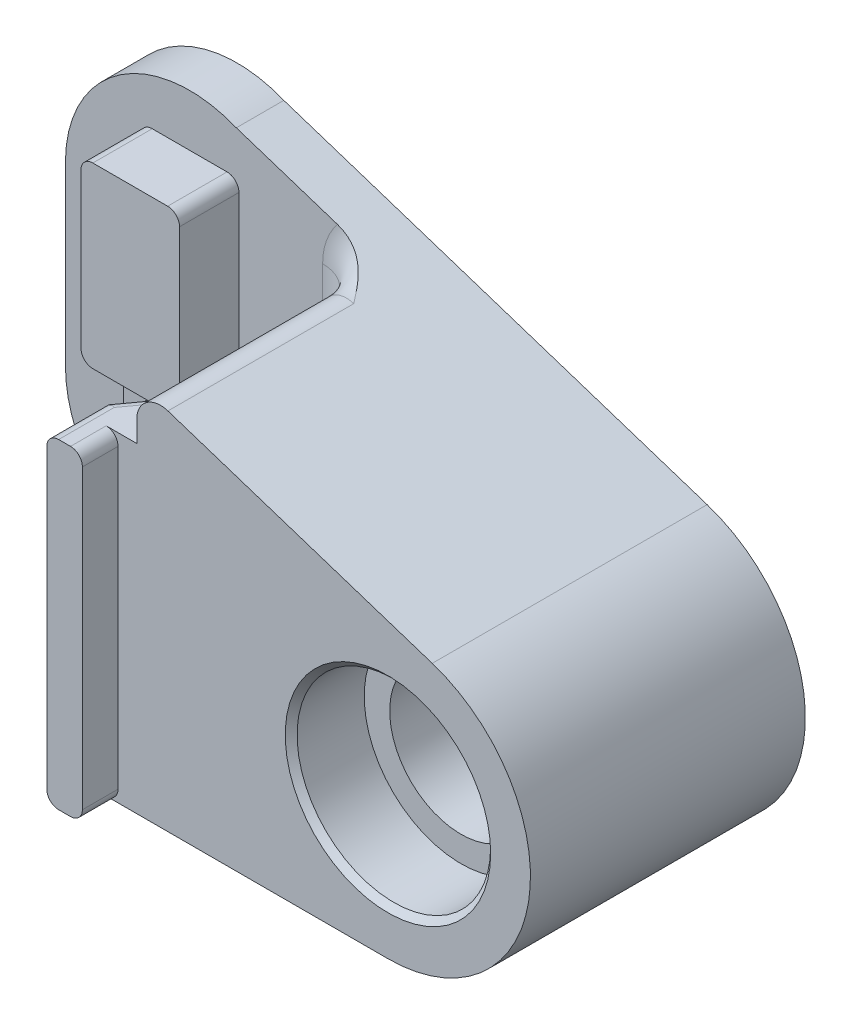
from build123d import *

# Parameters (mm, degrees)
SKETCH_1_R          = 3.2500000000000004
SKETCH_1_R_2        = 8.149999999999999
EXTRUDE_1_DEPTH     = 4
SKETCH_1_3_R        = 11.999999999999993
SKETCH_1_3_R_2      = 8.149999999999999
SKETCH_1_3_R_3      = 9.500000000000002
EXTRUDE_2_DEPTH     = 23.15
EXTRUDE_START       = 9
SKETCH_1_4_R        = 8.149999999999999
SKETCH_1_4_R_2      = 5.999999999999998
EXTRUDE_3_DEPTH     = 8
EXTRUDE_4_DEPTH     = 9.000000000000002
FILLET_1_R          = 2
EXTRUDE_5_DEPTH     = 27
FILLET_2_R          = 1
SKETCH_1_6_R        = 9.500000000000002
SKETCH_1_6_R_2      = 8.149999999999999
CUT_EXTRUDE_1_DEPTH = 2
CHAMFER_1_SIZE      = 2.3
CHAMFER_2_SIZE      = 1.3
FILLET_4_R          = 3.5
SKETCH_1_7_R        = 3.2500000000000004
EXTRUDE_6_DEPTH     = 5.4
FILLET_3_R          = 1
CHAMFER_3_SIZE      = 0.5


with BuildPart() as part:
    # Эскиз1 → Бобышка-Вытянуть1 (new body)
    with BuildSketch(Plane.XY):
        with BuildLine():
            Line((-14.999999999999972, -8.963730931198981), (20.850000000000577, -8.96373093119897))
            ThreePointArc((20.85000000000058, -8.963730931198967), (32.70050757538239, 1.1480237971749345), (24.57944414926456, 14.44202403449797))
            Line((24.57944414926456, 14.44202403449797), (-11.068586896529624, 26.098187192163547))
            ThreePointArc((-11.068586896529625, 26.098187192163547), (-20.788047002520305, 25.117990405859814), (-25.455246310980815, 16.536269068801015))
            Line((-25.455246310980815, 16.536269068801015), (-25.45524631098081, 1.4915153797818874))
            ThreePointArc((-25.45524631098081, 1.4915153797818874), (-22.392975565470174, -5.9014601856883235), (-14.999999999999972, -8.96373093119898))
        make_face()
        Polygon((-10.849999999999971, 7.491515379781886), (-19.149999999999974, 7.491515379781886), (-19.149999999999974, 22.491515379781884), (-10.849999999999973, 22.491515379781884), align=None, mode=Mode.SUBTRACT)
        with Locations((-14.999999999999972, 1.4915153797818852)):
            Circle(SKETCH_1_R, mode=Mode.SUBTRACT)
        with Locations((20.85000000000058, 3.036269068801026)):
            Circle(SKETCH_1_R_2, mode=Mode.SUBTRACT)
    extrude(amount=EXTRUDE_1_DEPTH)

    # Эскиз1<3> → Бобышка-Вытянуть2 (add)
    # profile 1 of 3: a face of its own
    with BuildSketch(Plane.XY):
        with BuildLine():
            Line((-0.29999999999996874, -8.96373093119897), (20.85000000000058, -8.96373093119897))
            ThreePointArc((20.850000000000577, -8.963730931198967), (8.999492424618776, 4.924514340427118), (24.57944414926456, 14.44202403449797))
            Line((24.57944414926456, 14.442024034497972), (-0.2999999999999723, 22.57708372133782))
            Line((-0.2999999999999722, 22.57708372133782), (-0.2999999999999704, -8.96373093119897))
        make_face()
    # profile 2 of 3: a face of its own
    with BuildSketch(Plane.XY):
        with Locations((20.85000000000058, 3.036269068801026)):
            Circle(SKETCH_1_3_R)
        with Locations((20.85000000000058, 3.036269068801026)):
            Circle(SKETCH_1_3_R_2, mode=Mode.SUBTRACT)
    # profile 3 of 3: a face of its own
    with BuildSketch(Plane.XY):
        with Locations((20.85000000000058, 3.036269068801026)):
            Circle(SKETCH_1_3_R_3)
        with Locations((20.85000000000058, 3.036269068801026)):
            Circle(SKETCH_1_3_R_2, mode=Mode.SUBTRACT)
    extrude(amount=EXTRUDE_2_DEPTH)

    # Эскиз1<4> → Бобышка-Вытянуть3 (add)
    with BuildSketch(Plane.XY.offset(EXTRUDE_START)):
        with Locations((20.85000000000058, 3.036269068801026)):
            Circle(SKETCH_1_4_R)
        with Locations((20.85000000000058, 3.036269068801026)):
            Circle(SKETCH_1_4_R_2, mode=Mode.SUBTRACT)
    extrude(amount=EXTRUDE_3_DEPTH)

    # Эскиз1<5> → Бобышка-Вытянуть4 (add)
    with BuildSketch(Plane.XY):
        Polygon((-10.849999999999971, 7.491515379781886), (-10.849999999999973, 22.491515379781884), (-19.149999999999974, 22.491515379781884), (-19.149999999999974, 7.491515379781886), align=None)
    extrude(amount=EXTRUDE_4_DEPTH)

    # Скругление1
    fillet_1_edges = [part.edges().sort_by_distance(p)[0] for p in [
        (-0.29999999999997223, 22.57708372133782, 13.575),
    ]]
    fillet(fillet_1_edges, radius=FILLET_1_R)

    # Эскиз4 → Бобышка-Вытянуть5 (add)
    with BuildSketch(Plane.XZ.offset(8.96373093119897)):
        Polygon((-4.879999999999971, 26.15), (-4.87999999999997, 21.15), (-0.2999999999999704, 14.85), (-0.2999999999999704, 23.150000000000002), (-1.8799999999999704, 23.150000000000002), (-1.8799999999999704, 26.15), align=None)
    extrude(amount=-EXTRUDE_5_DEPTH)

    # Скругление2
    fillet_2_edges = [part.edges().sort_by_distance(p)[0] for p in [
        (-0.29999999999996957, -8.96373093119897, 9.425),
        (-2.589999999999968, 18.03626906880103, 18),
        (-4.879999999999969, 18.03626906880103, 23.65),
        (-1.8799999999999681, 18.03626906880103, 24.65),
        (-2.58999999999997, -8.96373093119897, 18),
        (-1.8799999999999704, -8.96373093119897, 24.65),
        (-4.879999999999971, -8.96373093119897, 23.65),
    ]]
    fillet(fillet_2_edges, radius=FILLET_2_R)

    # Эскиз1<6> → Вырез-Вытянуть1 (cut)
    with BuildSketch(Plane.XY):
        with Locations((20.85000000000058, 3.036269068801026)):
            Circle(SKETCH_1_6_R)
        with Locations((20.85000000000058, 3.036269068801026)):
            Circle(SKETCH_1_6_R_2, mode=Mode.SUBTRACT)
    extrude(amount=CUT_EXTRUDE_1_DEPTH, mode=Mode.SUBTRACT)

    # Фаска1
    # the kernel refuses this chamfer: 2.3 mm, written as the material it takes off along each edge
    with BuildSketch(Plane(origin=(20.85000000000058, 3.036269068801026, 9), x_dir=(1, 0, 0), z_dir=(0, -1, 0))) as chamfer_1_piece_1_section:
        Polygon((5.9999999999999964, CHAMFER_1_SIZE), (5.9999999999999964 + CHAMFER_1_SIZE, 0), (5.9999999999999964, 0), align=None)
    chamfer_1_piece_1 = revolve(axis=Axis((20.85000000000058, 3.036269068801026, 9), (0, 0, 1)), mode=Mode.PRIVATE)
    chamfer_1_piece_1 = chamfer_1_piece_1 & Plane(origin=(20.85000000000058, 3.036269068801026, 10.222457747954977), x_dir=(1, 0, 0), z_dir=(0, 0, -1)) * Cylinder(8.149999999999999, 34, mode=Mode.PRIVATE)
    add(chamfer_1_piece_1, mode=Mode.SUBTRACT)

    # Фаска2
    chamfer_2_edges = [part.edges().sort_by_distance(p)[0] for p in [
        (12.700000000000582, 3.036269068801027, 2),
    ]]
    chamfer(chamfer_2_edges, length=CHAMFER_2_SIZE)

    # Скругление4
    # the kernel refuses this fillet: 3.5 mm, written as the material it adds along each edge
    with BuildSketch(Plane(origin=(0.7000000000000293, -7.963730931198976, 4), x_dir=(-0.9999802608561372, 0.006283143965558403, 0), z_dir=(-0.006283143965558403, -0.9999802608561372, 0))) as fillet_4_piece_1_section:
        with BuildLine():
            CenterArc((-0.9999999999999992 - FILLET_4_R, -FILLET_4_R), FILLET_4_R, 0, 90)
            Line((-0.9999999999999979, -FILLET_4_R), (-0.9999999999999992, 0))
            Line((-0.9999999999999992, 0), (-0.9999999999999992 - FILLET_4_R, 0))
        make_face()
    fillet_4_piece_1 = revolve(axis=Axis((0.7000000000000293, -7.963730931198976, 4), (0, 0, -1)), revolution_arc=359.64000000000004, mode=Mode.PRIVATE)
    fillet_4_piece_1 = split(fillet_4_piece_1, bisect_by=Plane(origin=(-0.06522476751896455, -8.963730931198977, 5.353005928395178), z_dir=(-3e-16, 1, 0)), keep=Keep.TOP, mode=Mode.PRIVATE)
    add(fillet_4_piece_1)
    with BuildSketch(Plane(origin=(-0.2999999999999705, -7.963730931198976, 4), x_dir=(-1, -6e-17, 0), z_dir=(-6e-17, 1, 0))) as fillet_4_piece_2:
        with BuildLine():
            CenterArc((FILLET_4_R, FILLET_4_R), FILLET_4_R, 180, 90)
            Line((-4.4e-16, FILLET_4_R), (0, 0))
            Line((0, 0), (FILLET_4_R, 0))
        make_face()
    extrude(amount=27.782655425625357)
    with BuildSketch(Plane(origin=(1.7000000000000277, 19.818924494426383, 4), x_dir=(-0.9998226837850567, -0.018830852047809543, 0), z_dir=(-0.018830852047809543, 0.9998226837850567, 0))) as fillet_4_piece_3_section:
        with BuildLine():
            CenterArc((-2.000000000000004 - FILLET_4_R, FILLET_4_R), FILLET_4_R, 270, 90)
            Line((-2.000000000000004, FILLET_4_R), (-2.000000000000004, 0))
            Line((-2.000000000000004, 0), (-2.000000000000004 - FILLET_4_R, 0))
        make_face()
    fillet_4_piece_3 = revolve(axis=Axis((1.7000000000000277, 19.818924494426383, 4), (0, 0, 1)), revolution_arc=358.921007878005, mode=Mode.PRIVATE)
    fillet_4_piece_3 = split(fillet_4_piece_3, bisect_by=Plane(origin=(0.6026329252520348, 22.28194156791278, 5.095559189965934), z_dir=(-0.3107870124386654, -0.950479580474746, 0)), keep=Keep.TOP, mode=Mode.PRIVATE)
    add(fillet_4_piece_3)

    # Эскиз1<7> → Бобышка-Вытянуть6 (add)
    with BuildSketch(Plane.XY):
        Polygon((-10.849999999999971, 7.491515379781886), (-19.149999999999974, 7.491515379781886), (-19.149999999999974, -4.508484620218114), (-10.849999999999971, -4.508484620218115), align=None)
        with Locations((-14.999999999999972, 1.4915153797818852)):
            Circle(SKETCH_1_7_R, mode=Mode.SUBTRACT)
    extrude(amount=EXTRUDE_6_DEPTH)

    # Скругление3
    fillet_3_edges = [part.edges().sort_by_distance(p)[0] for p in [
        (-19.149999999999974, -4.508484620218114, 4.7),
        (-10.849999999999971, -4.508484620218114, 4.7),
        (-19.149999999999974, 22.491515379781884, 6.500000000000001),
        (-19.149999999999974, 7.491515379781886, 7.200000000000001),
        (-10.849999999999971, 7.491515379781886, 7.200000000000001),
        (-10.849999999999973, 22.491515379781884, 6.500000000000001),
    ]]
    fillet(fillet_3_edges, radius=FILLET_3_R)

    # Фаска3
    chamfer_3_edges = [part.edges().sort_by_distance(p)[0] for p in [
        (11.350000000000579, 3.0362690688010274, 0),
        (12.700000000000582, 3.036269068801027, 23.15),
    ]]
    chamfer(chamfer_3_edges, length=CHAMFER_3_SIZE)


solid = part.part
